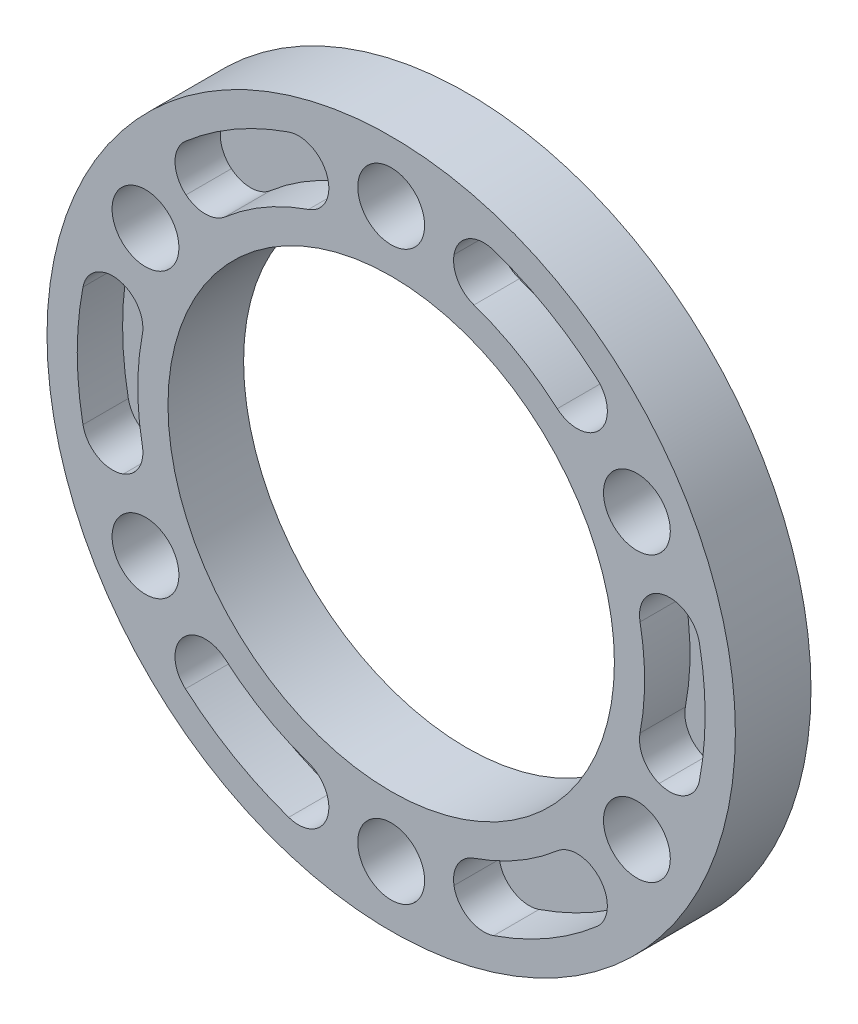
from build123d import *

# Parameters (mm, degrees)
SKETCH1_R           = 28.9052
SKETCH1_R_2         = 2.8067
SKETCH1_R_3         = 18.7452
BOSS_EXTRUDE1_DEPTH = 6.35
SHELL1_T            = -2.54
FILLET1_R           = 2.54


with BuildPart() as part:
    # Sketch1 → Boss-Extrude1 (new body)
    with BuildSketch(Plane.XY):
        Circle(SKETCH1_R)
        with Locations((0, 23.8252)):
            Circle(SKETCH1_R_2, mode=Mode.SUBTRACT)
        with Locations((20.63322845, 11.9126)):
            Circle(SKETCH1_R_2, mode=Mode.SUBTRACT)
        with Locations((20.63322845, -11.9126)):
            Circle(SKETCH1_R_2, mode=Mode.SUBTRACT)
        with Locations((0, -23.8252)):
            Circle(SKETCH1_R_2, mode=Mode.SUBTRACT)
        with Locations((-20.63322845, -11.9126)):
            Circle(SKETCH1_R_2, mode=Mode.SUBTRACT)
        with Locations((-20.63322845, 11.9126)):
            Circle(SKETCH1_R_2, mode=Mode.SUBTRACT)
        Circle(SKETCH1_R_3, mode=Mode.SUBTRACT)
    extrude(amount=BOSS_EXTRUDE1_DEPTH)

    # Shell1
    shell1_openings = [part.faces().sort_by_distance(p)[0] for p in [
        (-28.087637483, 0, 6.35),
    ]]
    offset(amount=SHELL1_T, openings=shell1_openings)

    # Fillet1
    fillet1_edges = [part.edges().sort_by_distance(p)[0] for p in [
        (20.242549419, -6.580192403, 4.445),
        (15.819888492, -14.240465833, 4.445),
        (24.894348466, -8.683040107, 4.445),
        (19.966907548, -17.217618129, 4.445),
        (24.894348466, 8.683040107, 4.445),
        (19.966907548, 17.217618129, 4.445),
        (20.242549419, 6.580192403, 4.445),
        (15.819888492, 14.240465833, 4.445),
        (-4.927440918, -25.900658236, 4.445),
        (4.927440918, -25.900658236, 4.445),
        (-4.422660927, -20.820658236, 4.445),
        (4.422660927, -20.820658236, 4.445),
        (-24.894348466, -8.683040107, 4.445),
        (-19.966907548, -17.217618129, 4.445),
        (-20.242549419, -6.580192403, 4.445),
        (-15.819888492, -14.240465833, 4.445),
        (-24.894348466, 8.683040107, 4.445),
        (-19.966907548, 17.217618129, 4.445),
        (-20.242549419, 6.580192403, 4.445),
        (-15.819888492, 14.240465833, 4.445),
        (-4.422660927, 20.820658236, 4.445),
        (4.422660927, 20.820658236, 4.445),
        (-4.927440918, 25.900658236, 4.445),
        (4.927440918, 25.900658236, 4.445),
    ]]
    fillet(fillet1_edges, radius=FILLET1_R - 0.0001)  # a hair under: the kernel refuses the full size


solid = part.part
